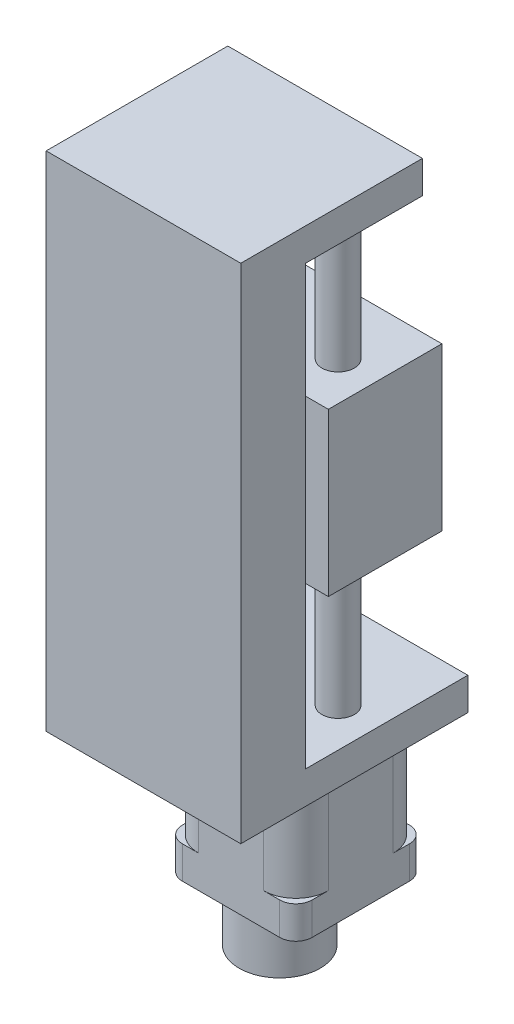
from build123d import *

# Parameters (mm, degrees)
SKETCH1_W           = 60
SKETCH1_H           = 70
BOSS_EXTRUDE1_DEPTH = 10
SKETCH2_R           = 5
BOSS_EXTRUDE2_DEPTH = 135
SKETCH3_W           = 60
SKETCH3_H           = 70
BOSS_EXTRUDE3_DEPTH = 10
SKETCH4_R           = 4
BOSS_EXTRUDE4_DEPTH = 135
SKETCH6_W           = 60
SKETCH6_H           = 20
BOSS_EXTRUDE5_DEPTH = 135
SKETCH7_W           = 40
SKETCH7_H           = 40
BOSS_EXTRUDE6_DEPTH = 46
SKETCH8_R           = 12.5
BOSS_EXTRUDE7_DEPTH = 17
FILLET1_START       = -36
FILLET1_DEPTH       = 26
FILLET2_R           = 5
FILLET3_START       = -36
FILLET3_DEPTH       = 26
FILLET4_R           = 5
SKETCH9_W           = 60
SKETCH9_H           = 35
BOSS_EXTRUDE8_DEPTH = 50
SKETCH10_W          = 60
SKETCH10_H          = 10
CUT_EXTRUDE1_DEPTH  = 14


with BuildPart() as part:
    # Sketch1 → Boss-Extrude1 (new body)
    with BuildSketch(Plane(origin=(0, 0, 0), x_dir=(1, 0, 0), z_dir=(0, 1, 0))):
        Rectangle(SKETCH1_W, SKETCH1_H)
    extrude(amount=BOSS_EXTRUDE1_DEPTH)

    # Sketch2 → Boss-Extrude2 (add)
    with BuildSketch(Plane(origin=(0, 10, 0), x_dir=(1, 0, 0), z_dir=(0, 1, 0))):
        with Locations(Location((-18, 7, 0), (0, 0, 270))):
            Circle(SKETCH2_R)
        with Locations(Location((18, 7, 0), (0, 0, 270))):
            Circle(SKETCH2_R)
    extrude(amount=BOSS_EXTRUDE2_DEPTH)

    # Sketch3 → Boss-Extrude3 (add)
    with BuildSketch(Plane(origin=(0, 145, 0), x_dir=(1, 0, 0), z_dir=(0, 1, 0))):
        Rectangle(SKETCH3_W, SKETCH3_H)
    extrude(amount=BOSS_EXTRUDE3_DEPTH)

    # Sketch4 → Boss-Extrude4 (add)
    with BuildSketch(Plane(origin=(0, 10, 0), x_dir=(1, 0, 0), z_dir=(0, 1, 0))):
        with Locations(Location((0, 7, 0), (0, 0, 270))):
            Circle(SKETCH4_R)
    extrude(amount=BOSS_EXTRUDE4_DEPTH)

    # Sketch6 → Boss-Extrude5 (add)
    with BuildSketch(Plane(origin=(0, 10, 0), x_dir=(1, 0, 0), z_dir=(0, 1, 0))):
        with Locations((0, -25)):
            Rectangle(SKETCH6_W, SKETCH6_H)
    extrude(amount=BOSS_EXTRUDE5_DEPTH)

    # Sketch7 → Boss-Extrude6 (add)
    with BuildSketch(Plane.XZ):
        with Locations((0, -12)):
            Rectangle(SKETCH7_W, SKETCH7_H)
    extrude(amount=BOSS_EXTRUDE6_DEPTH)

    # Sketch8 → Boss-Extrude7 (add)
    with BuildSketch(Plane.XZ.offset(46)):
        with Locations(Location((0, -7, 0), (0, 0, 270))):
            Circle(SKETCH8_R)
    extrude(amount=BOSS_EXTRUDE7_DEPTH)

    # Fillet1: read off the stored shape, not the designer's step
    # Fillet1 outline → Fillet1 (cut)
    with BuildSketch(Plane(origin=(0, 0, 0), x_dir=(1, 0, 0), z_dir=(0, 1, 0)).offset(FILLET1_START)):
        with BuildLine():
            Line((-20, 32), (-20, 22))
            ThreePointArc((-20, 22), (-17.071067812, 29.071067812), (-10, 32))
            Line((-10, 32), (-20, 32))
        make_face()
    extrude(amount=FILLET1_DEPTH, mode=Mode.SUBTRACT)

    # Fillet2
    fillet2_edges = [part.edges().sort_by_distance(p)[0] for p in [
        (-20, -41, -32),
        (-20, -5, -32),
    ]]
    fillet(fillet2_edges, radius=FILLET2_R)

    # Fillet3: read off the stored shape, not the designer's step
    # Fillet3 outline → Fillet3 (cut)
    with BuildSketch(Plane(origin=(0, 0, 0), x_dir=(1, 0, 0), z_dir=(0, 1, 0)).offset(FILLET3_START)):
        with BuildLine():
            ThreePointArc((10, 32), (17.071067812, 29.071067812), (20, 22))
            Line((20, 22), (20, 32))
            Line((20, 32), (10, 32))
        make_face()
        with BuildLine():
            ThreePointArc((20, 2), (17.071067812, -5.071067812), (10, -8))
            Line((10, -8), (20, -8))
            Line((20, -8), (20, 2))
        make_face()
        with BuildLine():
            ThreePointArc((-10, -8), (-17.071067812, -5.071067812), (-20, 2))
            Line((-20, 2), (-20, -8))
            Line((-20, -8), (-10, -8))
        make_face()
    extrude(amount=FILLET3_DEPTH, mode=Mode.SUBTRACT)

    # Fillet4
    fillet4_edges = [part.edges().sort_by_distance(p)[0] for p in [
        (20, -41, -32),
        (20, -41, 8),
        (-20, -41, 8),
        (20, -5, 8),
        (20, -5, -32),
        (-20, -5, 8),
    ]]
    fillet(fillet4_edges, radius=FILLET4_R)

    # Sketch9 → Boss-Extrude8 (add)
    with BuildSketch(Plane(origin=(0, 52.5, 0), x_dir=(1, 0, 0), z_dir=(0, 1, 0))):
        with Locations((0, 9.5)):
            Rectangle(SKETCH9_W, SKETCH9_H)
    extrude(amount=BOSS_EXTRUDE8_DEPTH)

    # Sketch10 → Cut-Extrude1 (cut)
    with BuildSketch(Plane(origin=(0, 0, -35), x_dir=(-1, 0, 0), z_dir=(0, 0, -1))):
        with Locations((0, 150)):
            Rectangle(SKETCH10_W, SKETCH10_H)
    extrude(amount=-CUT_EXTRUDE1_DEPTH, mode=Mode.SUBTRACT)


solid = part.part
